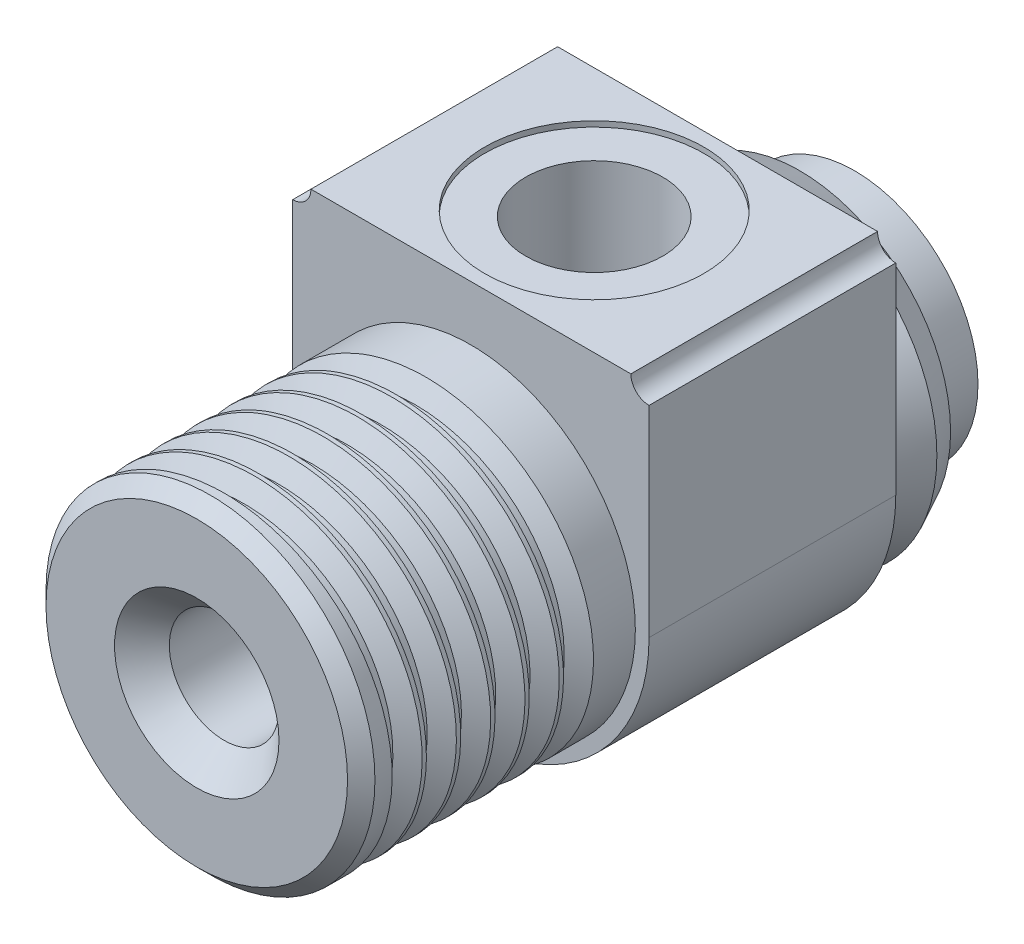
from build123d import *
from build123d.topology import SkipClean

# Parameters (mm, degrees)
SKETCH1_R                = 5.5
SKETCH2_R                = 6
SKETCH4_R                = 6
SKETCH3_R                = 5
SKETCH5_R                = 6.5
BOSS_EXTRUDE1_DEPTH      = 9
BOSS_EXTRUDE2_REACH      = 21.912
BOSS_EXTRUDE2_END_RADIUS = 6.5
SKETCH6_W                = 13
SKETCH6_H                = 9
CUT_EXTRUDE1_DEPTH       = 9
SKETCH8_R                = 6
BOSS_EXTRUDE3_DEPTH      = 10
SKETCH15_R               = 2
CUT_EXTRUDE2_DEPTH       = 25.295061317
CHAMFER1_SIZE            = 1
SKETCH16_R               = 4
CUT_EXTRUDE4_DEPTH       = 0.2
SKETCH17_R               = 2.5
CUT_EXTRUDE7_DEPTH       = 10
SKETCH18_R               = 4.5
BOSS_EXTRUDE4_DEPTH      = 2
CUT_EXTRUDE8_REACH       = 28.12
SKETCH19_R               = 2
CHAMFER2_SIZE            = 0.5
THREAD1_PITCH            = 1.25


with BuildPart() as part:
    # Sketch1 → Loft1 section 0
    with BuildSketch(Plane.XY):
        Circle(SKETCH1_R)
    # Sketch2 → Loft1 section 1
    with BuildSketch(Plane.XY.offset(1)):
        Circle(SKETCH2_R)
    loft()

    # Sketch4 → Loft3 section 0
    with BuildSketch(Plane.XY.offset(1)):
        Circle(SKETCH4_R)
    # Sketch3 → Loft3 section 1
    with BuildSketch(Plane.XY.offset(3)):
        Circle(SKETCH3_R)
    loft()

    # Sketch5 → Boss-Extrude1 (add)
    with BuildSketch(Plane.XY.offset(3)):
        Circle(SKETCH5_R)
    extrude(amount=BOSS_EXTRUDE1_DEPTH)

    # Boss-Extrude2: up to this cylinder (the profile starts outside it)
    boss_extrude2_end = Plane(origin=(0, 0, 7.5), z_dir=(0, 0, -1)) * Cylinder(BOSS_EXTRUDE2_END_RADIUS, 57.824, mode=Mode.PRIVATE)
    # Sketch6 → Boss-Extrude2 (add, up to the surface)
    with BuildSketch(Plane(origin=(0, 8, 0), x_dir=(1, 0, 0), z_dir=(0, 1, 0)), mode=Mode.PRIVATE) as boss_extrude2_sk1:
        with Locations((0, -7.5)):
            Rectangle(SKETCH6_W, SKETCH6_H)
    boss_extrude2_tool1 = extrude(boss_extrude2_sk1.sketch, amount=-BOSS_EXTRUDE2_REACH, mode=Mode.PRIVATE) - boss_extrude2_end
    add(boss_extrude2_tool1.solids().sort_by_distance((0, 8, 7.5))[0])

    # Sketch7 → Cut-Extrude1 (cut)
    with BuildSketch(Plane(origin=(0, 0, 3), x_dir=(-1, 0, 0), z_dir=(0, 0, -1))):
        with BuildLine():
            Line((-6.5, 8), (-5.835999771, 8))
            ThreePointArc((-5.835999771, 8), (-6.030480936, 7.530480936), (-6.5, 7.335999771))
            Line((-6.5, 7.335999771), (-6.5, 8))
        make_face()
        with BuildLine():
            Line((5.835999771, 8), (6.5, 8))
            Line((6.5, 8), (6.5, 7.335999771))
            ThreePointArc((6.5, 7.335999771), (6.030480936, 7.530480936), (5.835999771, 8))
        make_face()
    extrude(amount=-CUT_EXTRUDE1_DEPTH, mode=Mode.SUBTRACT)

    # Sketch8 → Boss-Extrude3 (add)
    with BuildSketch(Plane.XY.offset(12)):
        Circle(SKETCH8_R)
    extrude(amount=BOSS_EXTRUDE3_DEPTH)

    # Sketch15 → Cut-Extrude2 (cut, through all)
    with BuildSketch(Plane.XY.offset(22)):
        Circle(SKETCH15_R)
    extrude(amount=-CUT_EXTRUDE2_DEPTH, mode=Mode.SUBTRACT)

    # Chamfer1
    chamfer1_edges = [part.edges().sort_by_distance(p)[0] for p in [
        (-2, 0, 22),
    ]]
    chamfer(chamfer1_edges, length=CHAMFER1_SIZE)

    # Sketch16 → Cut-Extrude4 (cut)
    with BuildSketch(Plane(origin=(0, 8, 0), x_dir=(1, 0, 0), z_dir=(0, 1, 0))):
        with Locations(Location((0, -7.5, 0), (0, 0, 270))):
            Circle(SKETCH16_R)
    extrude(amount=-CUT_EXTRUDE4_DEPTH, mode=Mode.SUBTRACT)

    # Sketch17 → Cut-Extrude7 (cut)
    with BuildSketch(Plane(origin=(0, 7.8, 0), x_dir=(1, 0, 0), z_dir=(0, 1, 0))):
        with Locations(Location((0, -7.5, 0), (0, 0, 270))):
            Circle(SKETCH17_R)
    extrude(amount=-CUT_EXTRUDE7_DEPTH, mode=Mode.SUBTRACT)

    # Sketch18 → Boss-Extrude4 (add)
    with BuildSketch(Plane(origin=(0, 0, 0), x_dir=(-1, 0, 0), z_dir=(0, 0, -1))):
        Circle(SKETCH18_R)
    extrude(amount=BOSS_EXTRUDE4_DEPTH)

    # Sketch19 → Cut-Extrude8 (cut, up to next)
    with BuildSketch(Plane(origin=(0, 0, -2), x_dir=(-1, 0, 0), z_dir=(0, 0, -1)), mode=Mode.PRIVATE) as cut_extrude8_sk1:
        with Locations(Location((0, 0, 0), (0, 0, 180))):
            Circle(SKETCH19_R)
    cut_extrude8_tool1 = extrude(cut_extrude8_sk1.sketch, amount=-CUT_EXTRUDE8_REACH, mode=Mode.PRIVATE) & part.part
    add(cut_extrude8_tool1.solids().sort_by_distance((0, 0, -2))[0], mode=Mode.SUBTRACT)

    # Chamfer2
    chamfer2_edges = [part.edges().sort_by_distance(p)[0] for p in [
        (-6, 0, 22),
    ]]
    chamfer(chamfer2_edges, length=CHAMFER2_SIZE)

    # Thread1: the profile of Thread Profile1 profile screwed along a right-hand helix of 6 turns, 8 arcs to a turn; built about Z, then put on its axis
    with SkipClean():  # the faces are left unmerged after this step: merging them gives an invalid solid
        thread1_z = Axis((0, 0, 0), (0, 0, 1))
        thread1_corners = [(6.0003, 0, -0.000173205), (6.0003, 0, 1.093923202), (5.323417656, 0, 0.703124998), (5.323417656, 0, 0.390624998)]
        with BuildLine(mode=Mode.PRIVATE) as thread1_profile:
            Line(thread1_corners[0], thread1_corners[1])
            Line(thread1_corners[1], thread1_corners[2])
            Line(thread1_corners[2], thread1_corners[3])
            Line(thread1_corners[3], thread1_corners[0])
        thread1_cap = Face(thread1_profile.wire())
        thread1_turn_angles = [0, 22.5, 45, 67.5, 90, 112.5, 135, 157.5, 180, 202.5, 225, 247.5, 270, 292.5, 315, 337.5, 360]
        thread1_turn_weights = [1, 0.9238795325112867, 1, 0.9238795325112867, 1, 0.9238795325112867, 1, 0.9238795325112867, 1, 0.9238795325112867, 1, 0.9238795325112867, 1, 0.9238795325112867, 1, 0.9238795325112867, 1]
        thread1_turn_rails = [Edge.make_bspline([Vector(p[0], p[1], 0).rotate(thread1_z, thread1_turn_angles[k]) / thread1_turn_weights[k] + Vector(0, 0, p[2] + THREAD1_PITCH * thread1_turn_angles[k] / 360) for k in range(17)], [0, 0, 0, 1, 1, 2, 2, 3, 3, 4, 4, 5, 5, 6, 6, 7, 7, 8, 8, 8], 2, thread1_turn_weights) for p in thread1_corners]
        thread1_turn_sides = [Face.make_surface_from_curves(thread1_turn_rails[p[0]], thread1_turn_rails[p[1]]) for p in [(0, 1), (1, 2), (2, 3), (3, 0)]]
        thread1_turn = Solid(Shell([*thread1_turn_sides, thread1_cap, thread1_cap.rotate(thread1_z, 360).moved(Location((0, 0, THREAD1_PITCH * 360 / 360)))]))
        thread1_each = [*[thread1_turn.moved(Location((0, 0, THREAD1_PITCH * i))) for i in range(6)]]
        add(Plane(origin=(0, 0, 21.5), x_dir=(-1, 0, 0), z_dir=(0, 0, -1)) * Compound([thread1_each[i] for i in range(0, 6, 2)]), mode=Mode.SUBTRACT)
        add(Plane(origin=(0, 0, 21.5), x_dir=(-1, 0, 0), z_dir=(0, 0, -1)) * Compound([thread1_each[i] for i in range(1, 6, 2)]), mode=Mode.SUBTRACT)


solid = part.part
